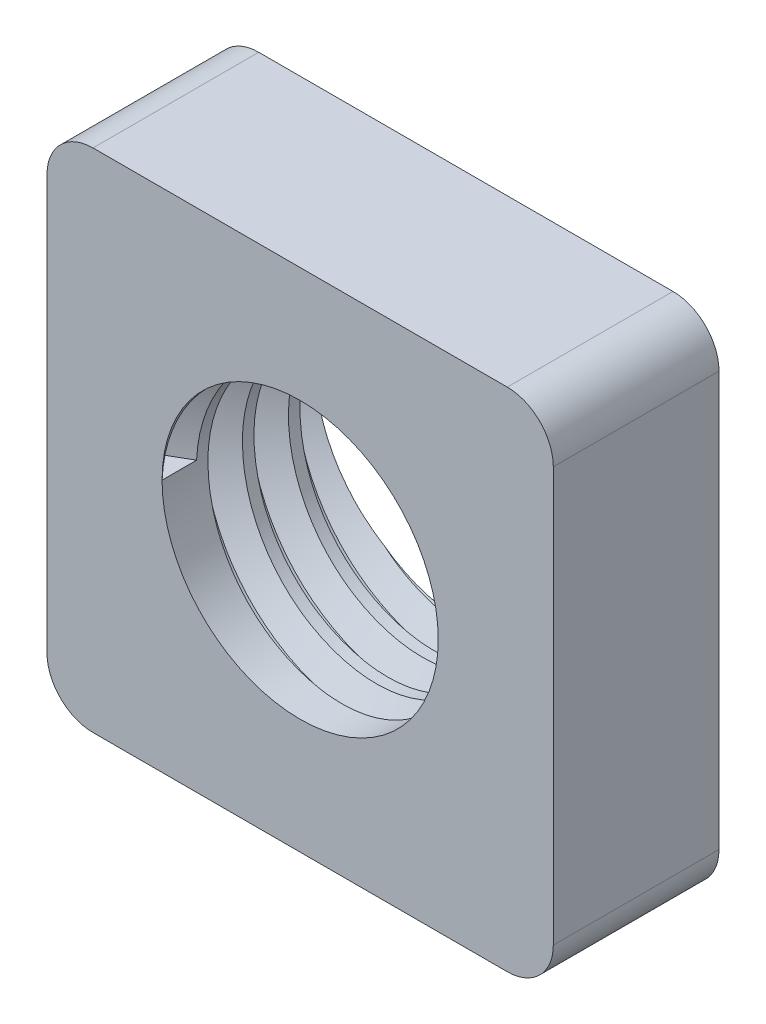
from build123d import *

# Parameters (mm, degrees)
SKETCH1_W           = 5.5
SKETCH1_H           = 5.5
SKETCH1_R           = 1.5
BOSS_EXTRUDE1_DEPTH = 1.8
FILLET1_R           = 0.5
THREAD1_PITCH       = 0.5


with BuildPart() as part:
    # Sketch1 → Boss-Extrude1 (new body)
    with BuildSketch(Plane.XY):
        Rectangle(SKETCH1_W, SKETCH1_H)
        Circle(SKETCH1_R, mode=Mode.SUBTRACT)
    extrude(amount=BOSS_EXTRUDE1_DEPTH)

    # Fillet1
    fillet1_edges = [part.edges().sort_by_distance(p)[0] for p in [
        (-2.75, 2.75, 0.9),
        (2.75, 2.75, 0.9),
        (2.75, -2.75, 0.9),
        (-2.75, -2.75, 0.9),
    ]]
    fillet(fillet1_edges, radius=FILLET1_R)

    # Thread1: the profile of Thread Profile1 profile screwed along a right-hand helix of 20 turns, 6 arcs to a turn; built about Z, then put on its axis
    thread1_z = Axis((0, 0, 0), (0, 0, 1))
    thread1_corners = [(1.4997, 0, -0.000173205), (1.770632938, 0, 0.156249999), (1.770632938, 0, 0.218749999), (1.4997, 0, 0.375173204)]
    with BuildLine(mode=Mode.PRIVATE) as thread1_profile:
        Line(thread1_corners[0], thread1_corners[1])
        Line(thread1_corners[1], thread1_corners[2])
        Line(thread1_corners[2], thread1_corners[3])
        Line(thread1_corners[3], thread1_corners[0])
    thread1_cap = Face(thread1_profile.wire())
    thread1_turn_angles = [0, 30, 60, 90, 120, 150, 180, 210, 240, 270, 300, 330, 360]
    thread1_turn_weights = [1, 0.8660254037844387, 1, 0.8660254037844387, 1, 0.8660254037844387, 1, 0.8660254037844387, 1, 0.8660254037844387, 1, 0.8660254037844387, 1]
    thread1_turn_rails = [Edge.make_bspline([Vector(p[0], p[1], 0).rotate(thread1_z, thread1_turn_angles[k]) / thread1_turn_weights[k] + Vector(0, 0, p[2] + THREAD1_PITCH * thread1_turn_angles[k] / 360) for k in range(13)], [0, 0, 0, 1, 1, 2, 2, 3, 3, 4, 4, 5, 5, 6, 6, 6], 2, thread1_turn_weights) for p in thread1_corners]
    thread1_turn_sides = [Face.make_surface_from_curves(thread1_turn_rails[p[0]], thread1_turn_rails[p[1]]) for p in [(0, 1), (1, 2), (2, 3), (3, 0)]]
    thread1 = Plane(origin=(0, 0, 1.8), x_dir=(-1, 0, 0), z_dir=(0, 0, -1)) * Solid(Shell([*[p.moved(Location((0, 0, THREAD1_PITCH * i))) for i in range(20) for p in thread1_turn_sides], thread1_cap, thread1_cap.rotate(thread1_z, 7200).moved(Location((0, 0, THREAD1_PITCH * 7200 / 360)))]))
    add(thread1, mode=Mode.SUBTRACT)


solid = part.part
